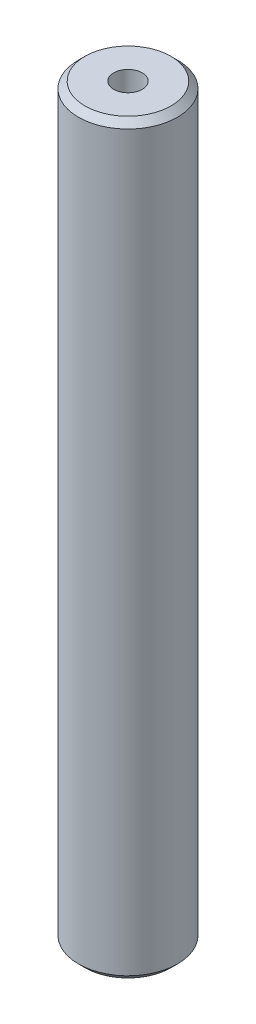
from build123d import *

# Parameters (mm, degrees)
SKETCH1_R           = 30
BOSS_EXTRUDE1_DEPTH = 452.085628988
SKETCH2_R           = 8.666693552
CUT_EXTRUDE1_DEPTH  = 455.072038268
CHAMFER1_SIZE       = 3.949371093


with BuildPart() as part:
    # Sketch1 → Boss-Extrude1 (new body)
    with BuildSketch(Plane(origin=(0, 0, 0), x_dir=(1, 0, 0), z_dir=(0, 1, 0))):
        Circle(SKETCH1_R)
    extrude(amount=BOSS_EXTRUDE1_DEPTH)

    # Sketch2 → Cut-Extrude1 (cut, through all)
    with BuildSketch(Plane(origin=(0, 0, 0), x_dir=(1, 0, 0), z_dir=(0, 1, 0))):
        Circle(SKETCH2_R)
    extrude(amount=CUT_EXTRUDE1_DEPTH, mode=Mode.SUBTRACT)

    # Chamfer1
    chamfer1_edges = [part.edges().sort_by_distance(p)[0] for p in [
        (-30, 452.085628988, 0),
        (-30, 0, 0),
    ]]
    chamfer(chamfer1_edges, length=CHAMFER1_SIZE)


solid = part.part
